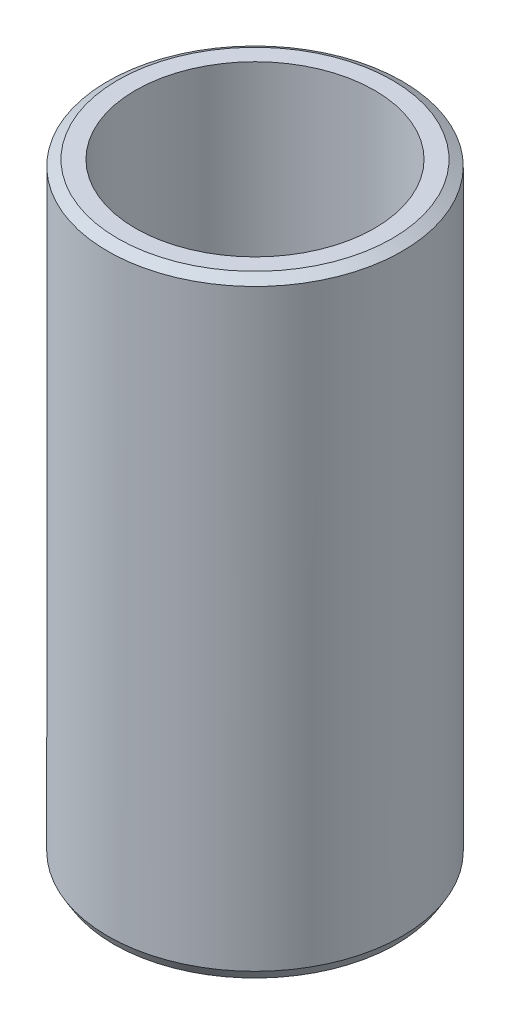
from build123d import *
from OCP.BRepFilletAPI import BRepFilletAPI_MakeChamfer

# Parameters (mm, degrees)
SKETCH1_R           = 47.5
BOSS_EXTRUDE1_DEPTH = 196.485747585
SKETCH2_R           = 38.558043073
CUT_EXTRUDE1_DEPTH  = 208.651508552
CHAMFER1_SIZE       = 1.936950082
CHAMFER1_SIZE2      = 3.243651065


with BuildPart() as part:
    # Sketch1 → Boss-Extrude1 (new body)
    with BuildSketch(Plane(origin=(0, 0, 0), x_dir=(1, 0, 0), z_dir=(0, 1, 0))):
        Circle(SKETCH1_R)
    extrude(amount=BOSS_EXTRUDE1_DEPTH)

    # Sketch2 → Cut-Extrude1 (cut, through all)
    with BuildSketch(Plane(origin=(0, 0, 0), x_dir=(1, 0, 0), z_dir=(0, 1, 0))):
        Circle(SKETCH2_R)
    extrude(amount=CUT_EXTRUDE1_DEPTH, mode=Mode.SUBTRACT)

    # Chamfer1: one chamfer whose edges measure the first distance from different faces: ONE call of the kernel's chamfer builder (chamfer() names one face for all edges)
    chamfer1_edges_1 = [part.edges().sort_by_distance(p)[0] for p in [
        (-47.5, 196.485747585, 0),
    ]]
    chamfer1_side_1 = [part.faces().sort_by_distance(p)[0] for p in [
        (-47.5, 98.242873793, 0),
    ]]
    chamfer1_edges_2 = [part.edges().sort_by_distance(p)[0] for p in [
        (-47.5, 0, 0),
    ]]
    chamfer1_side_2 = [part.faces().sort_by_distance(p)[0] for p in [
        (-46.156497116, 0, 0),
    ]]
    chamfer1 = BRepFilletAPI_MakeChamfer(part.part.solid().wrapped)
    for e in chamfer1_edges_1:
        chamfer1.Add(CHAMFER1_SIZE, CHAMFER1_SIZE2, e.wrapped, chamfer1_side_1[0].wrapped)  # the first distance lies on this face
    for e in chamfer1_edges_2:
        chamfer1.Add(CHAMFER1_SIZE, CHAMFER1_SIZE2, e.wrapped, chamfer1_side_2[0].wrapped)  # the first distance lies on this face
    add(Compound.cast(chamfer1.Shape()), mode=Mode.REPLACE)


solid = part.part
